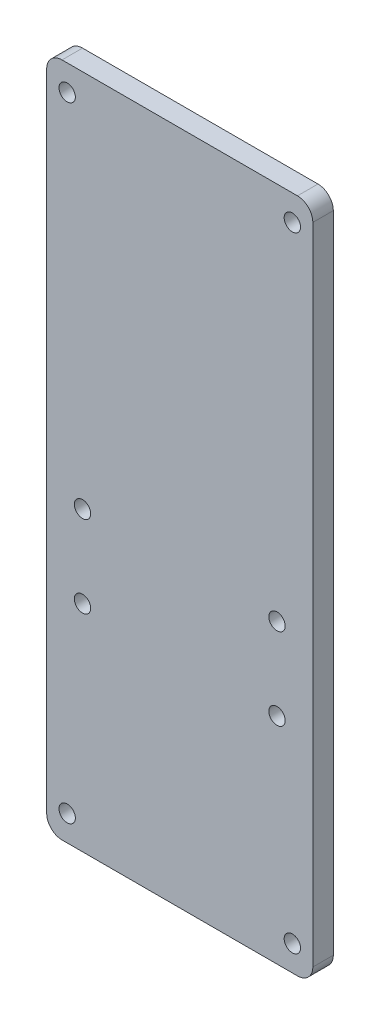
from build123d import *

# Parameters (mm, degrees)
SKETCH1_R           = 1.6
BOSS_EXTRUDE1_DEPTH = 4


with BuildPart() as part:
    # Sketch1 → Boss-Extrude1 (new body)
    with BuildSketch(Plane.XY):
        with BuildLine():
            Line((23.206941284, 124.936391703), (23.206941284, -1.063608297))
            ThreePointArc((23.206941284, -1.063608297), (24.085620941, -3.184928641), (26.206941284, -4.063608297))
            Line((26.206941284, -4.063608297), (72.208519176, -4.063608297))
            ThreePointArc((72.208519176, -4.063608297), (74.32983952, -3.184928641), (75.208519176, -1.063608297))
            Line((75.208519176, -1.063608297), (75.208519176, 124.936391703))
            ThreePointArc((75.208519176, 124.936391703), (74.32983952, 127.057712046), (72.208519176, 127.936391703))
            Line((72.208519176, 127.936391703), (26.206941284, 127.936391703))
            ThreePointArc((26.206941284, 127.936391703), (24.085620941, 127.057712046), (23.206941284, 124.936391703))
        make_face()
        with Locations((30.20773023, 53.936391703)):
            Circle(SKETCH1_R, mode=Mode.SUBTRACT)
        with Locations((27.206941284, 0.936391703)):
            Circle(SKETCH1_R, mode=Mode.SUBTRACT)
        with Locations((30.20773023, 37.936391703)):
            Circle(SKETCH1_R, mode=Mode.SUBTRACT)
        with Locations((71.208519176, 122.936391703)):
            Circle(SKETCH1_R, mode=Mode.SUBTRACT)
        with Locations((71.208519176, 0.936391703)):
            Circle(SKETCH1_R, mode=Mode.SUBTRACT)
        with Locations((68.20773023, 53.936391703)):
            Circle(SKETCH1_R, mode=Mode.SUBTRACT)
        with Locations((27.206941284, 122.936391703)):
            Circle(SKETCH1_R, mode=Mode.SUBTRACT)
        with Locations((68.20773023, 37.936391703)):
            Circle(SKETCH1_R, mode=Mode.SUBTRACT)
    extrude(amount=BOSS_EXTRUDE1_DEPTH)


solid = part.part
